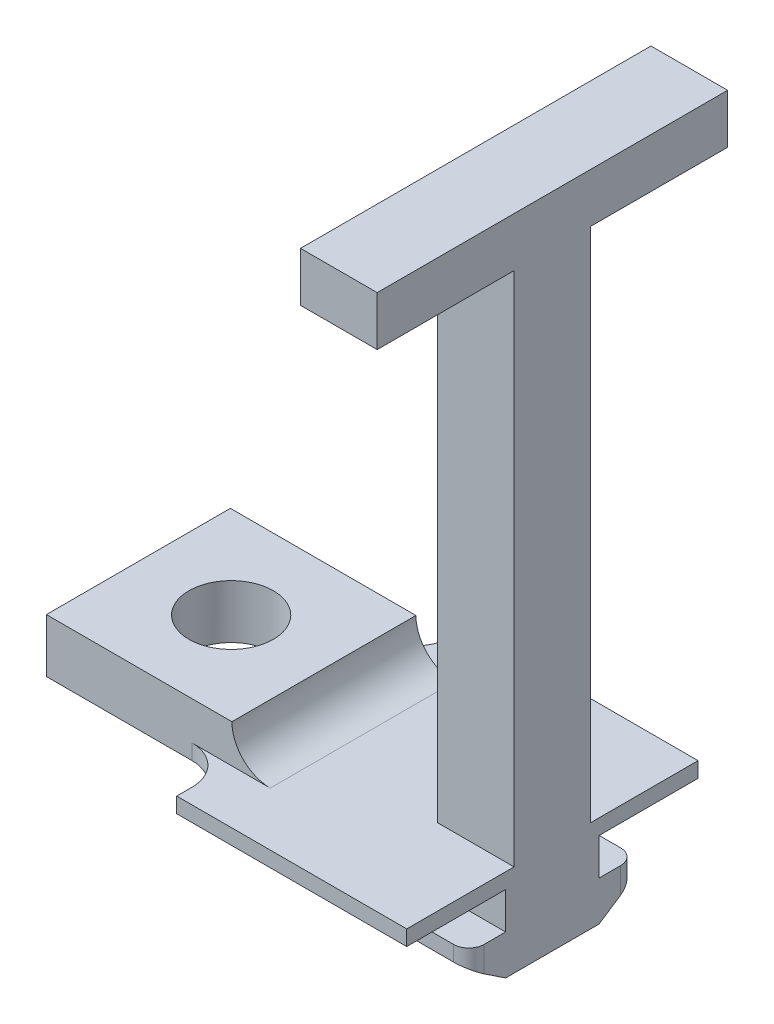
from build123d import *

# Parameters (mm, degrees)
SKETCH1_W                 = 22.85439833
SKETCH1_H                 = 3.220407414
BOSS_EXTRUDE1_DEPTH       = 5
SKETCH2_W                 = 5
SKETCH2_H                 = 37.897484117
BOSS_EXTRUDE2_DEPTH       = 5
BOSS_EXTRUDE3_DEPTH       = 15
FILLET1_R                 = 1
BOSS_EXTRUDE28_DEPTH      = 12
BOSS_EXTRUDE28_DEPTH_BACK = 0.1
SKETCH38_W                = 12
SKETCH38_H                = 3.5
CUT_EXTRUDE3_REACH        = 47.197
SKETCH39_R                = 2.75
FILLET2_R                 = 2.5


with BuildPart() as part:
    # Sketch1 → Boss-Extrude1 (new body)
    with BuildSketch(Plane(origin=(0, 0, 0), x_dir=(0, 0, -1), z_dir=(1, 0, 0))):
        Rectangle(SKETCH1_W, SKETCH1_H)
    extrude(amount=-BOSS_EXTRUDE1_DEPTH)

    # Sketch2 → Boss-Extrude2 (add)
    with BuildSketch(Plane(origin=(0, 0, 0), x_dir=(0, 0, -1), z_dir=(1, 0, 0))):
        with Locations((0, -17.338538351)):
            Rectangle(SKETCH2_W, SKETCH2_H)
    extrude(amount=-BOSS_EXTRUDE2_DEPTH)

    # Sketch3 → Boss-Extrude3 (add)
    with BuildSketch(Plane(origin=(0, 0, 0), x_dir=(0, 0, -1), z_dir=(1, 0, 0))):
        Polygon((-9.5, -36.28728041), (-9.5, -35.28728041), (9.5, -35.28728041), (9.5, -36.28728041), (3.05, -36.28728041), (3.05, -38.68728041), (5.45, -38.68728041), (5.45, -39.68728041), (3.05, -41.28728041), (-3.05, -41.28728041), (-5.45, -39.68728041), (-5.45, -38.68728041), (-3.05, -38.68728041), (-3.05, -36.28728041), align=None)
    extrude(amount=-BOSS_EXTRUDE3_DEPTH)

    # Fillet1
    fillet1_edges = [part.edges().sort_by_distance(p)[0] for p in [
        (0, -39.18728041, 5.45),
        (0, -39.18728041, -5.45),
    ]]
    fillet(fillet1_edges, radius=FILLET1_R)

    # Sketch38 → Boss-Extrude28 (add, two sides: drawn at the far end of the back side and taken through both)
    with BuildSketch(Plane.ZY.offset(15).offset(-BOSS_EXTRUDE28_DEPTH_BACK)):
        with Locations((0, -34.53728041)):
            Rectangle(SKETCH38_W, SKETCH38_H)
    extrude(amount=BOSS_EXTRUDE28_DEPTH + BOSS_EXTRUDE28_DEPTH_BACK)

    # Sketch39 → Cut-Extrude3 (cut, up to next)
    with BuildSketch(Plane(origin=(0, -32.78728041, 0), x_dir=(1, 0, 0), z_dir=(0, 1, 0)), mode=Mode.PRIVATE) as cut_extrude3_sk1:
        with Locations(Location((-20.95, 0, 0), (0, 0, 270))):
            Circle(SKETCH39_R)
    cut_extrude3_tool1 = extrude(cut_extrude3_sk1.sketch, amount=-CUT_EXTRUDE3_REACH, mode=Mode.PRIVATE) & part.part
    add(cut_extrude3_tool1.solids().sort_by_distance((-20.95, -32.78728, 0))[0], mode=Mode.SUBTRACT)

    # Fillet2
    fillet2_edges = [part.edges().sort_by_distance(p)[0] for p in [
        (-14.9, -35.28728041, 0),
        (-15, -35.78728041, -6),
        (-15, -35.78728041, 6),
    ]]
    fillet(fillet2_edges, radius=FILLET2_R - 0.0001)  # a hair under: the kernel refuses the full size


solid = part.part
